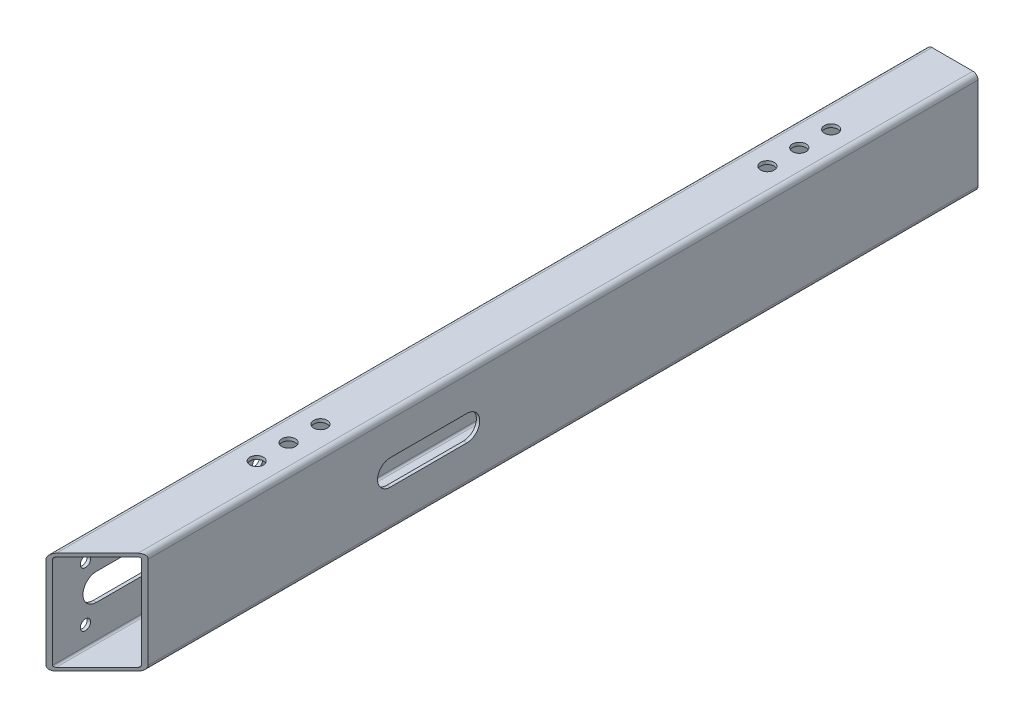
from build123d import *

# Parameters (mm, degrees)
EXTRUDE_THIN1_START       = -406.4
EXTRUDE_THIN1_DEPTH       = 438.15
EXTRUDE_THIN1_START_2     = 13.470384182
EXTRUDE_THIN1_2_OUTLINE_W = 39
EXTRUDE_THIN1_2_OUTLINE_H = 54
EXTRUDE_THIN1_2_DEPTH     = 18.529615818
CUT_EXTRUDE2_REACH        = 409.984
CUT_EXTRUDE4_REACH        = 409.984
SKETCH5_R                 = 2.5527
CUT_EXTRUDE3_DEPTH        = 1.651
F_1_4_CLEARANCE_HOLE1_D   = 6.7564


with BuildPart() as part:
    # Extrude-Thin1: read off the stored shape, not the designer's step
    # Extrude-Thin1 outline → Extrude-Thin1 (new body)
    with BuildSketch(Plane.XY.offset(EXTRUDE_THIN1_START)):
        with BuildLine():
            ThreePointArc((-12.7, -22.86), (-11.956051224, -24.656051224), (-10.16, -25.4))
            Line((-10.16, -25.4), (10.16, -25.4))
            ThreePointArc((10.16, -25.4), (11.956051224, -24.656051224), (12.7, -22.86))
            Line((12.7, -22.86), (12.7, 22.86))
            ThreePointArc((12.7, 22.86), (11.956051224, 24.656051224), (10.16, 25.4))
            Line((10.16, 25.4), (-10.16, 25.4))
            ThreePointArc((-10.16, 25.4), (-11.956051224, 24.656051224), (-12.7, 22.86))
            Line((-12.7, 22.86), (-12.7, -22.86))
        make_face()
        with BuildLine():
            Line((10.16, -23.749), (-10.16, -23.749))
            ThreePointArc((-10.16, -23.749), (-10.788617928, -23.488617928), (-11.049, -22.86))
            Line((-11.049, -22.86), (-11.049, 22.86))
            ThreePointArc((-11.049, 22.86), (-10.788617928, 23.488617928), (-10.16, 23.749))
            Line((-10.16, 23.749), (10.16, 23.749))
            ThreePointArc((10.16, 23.749), (10.788617928, 23.488617928), (11.049, 22.86))
            Line((11.049, 22.86), (11.049, -22.86))
            ThreePointArc((11.049, -22.86), (10.788617928, -23.488617928), (10.16, -23.749))
        make_face(mode=Mode.SUBTRACT)
    extrude(amount=EXTRUDE_THIN1_DEPTH)

    # Extrude-Thin1 2 outline → Extrude-Thin1 2 (cut)
    with BuildSketch(Plane(origin=(0, 0, 0), x_dir=(0.707106781186548, 0, -0.707106781186547), z_dir=(0.707106781186547, 0, 0.707106781186548)).offset(EXTRUDE_THIN1_START_2)):
        with Locations((-13.5, 0)):
            Rectangle(EXTRUDE_THIN1_2_OUTLINE_W, EXTRUDE_THIN1_2_OUTLINE_H)
    extrude(amount=EXTRUDE_THIN1_2_DEPTH, mode=Mode.SUBTRACT)

    # Sketch3 → Cut-Extrude2 (cut, up to next)
    with BuildSketch(Plane.ZY.offset(12.7), mode=Mode.PRIVATE) as cut_extrude2_sk1:
        with BuildLine():
            Line((8.345953821, -6.6675), (-152.204543073, -6.6675))
            ThreePointArc((-152.204543073, -6.6675), (-158.872043073, 0), (-152.204543073, 6.6675))
            Line((-152.204543073, 6.6675), (8.345953821, 6.6675))
            ThreePointArc((8.345953821, 6.6675), (15.013453821, 0), (8.345953821, -6.6675))
        make_face()
    cut_extrude2_tool1 = extrude(cut_extrude2_sk1.sketch, amount=-CUT_EXTRUDE2_REACH, mode=Mode.PRIVATE) & part.part
    add(cut_extrude2_tool1.solids().sort_by_distance((-12.7, 0, -71.929295))[0], mode=Mode.SUBTRACT)

    # Sketch6 → Cut-Extrude4 (cut, up to next)
    with BuildSketch(Plane(origin=(12.7, 0, 0), x_dir=(0, 0, -1), z_dir=(1, 0, 0)), mode=Mode.PRIVATE) as cut_extrude4_sk1:
        with BuildLine():
            Line((114.104543073, 6.35), (152.204543073, 6.35))
            ThreePointArc((152.204543073, 6.35), (158.554543073, 0), (152.204543073, -6.35))
            Line((152.204543073, -6.35), (114.104543073, -6.35))
            ThreePointArc((114.104543073, -6.35), (107.754543073, 0), (114.104543073, 6.35))
        make_face()
    cut_extrude4_tool1 = extrude(cut_extrude4_sk1.sketch, amount=-CUT_EXTRUDE4_REACH, mode=Mode.PRIVATE) & part.part
    add(cut_extrude4_tool1.solids().sort_by_distance((12.7, 0, -133.154543))[0], mode=Mode.SUBTRACT)

    # Sketch5 → Cut-Extrude3 (cut)
    with BuildSketch(Plane(origin=(-12.7, 0, 0), x_dir=(0, 0, -1), z_dir=(1, 0, 0))):
        with Locations((-13.795705431, 13.589)):
            Circle(SKETCH5_R)
        with Locations((-13.795705431, -13.589)):
            Circle(SKETCH5_R)
        with Locations((71.929294569, -13.589)):
            Circle(SKETCH5_R)
        with Locations((71.929294569, 13.589)):
            Circle(SKETCH5_R)
        with Locations((157.654294569, 13.589)):
            Circle(SKETCH5_R)
        with Locations((157.654294569, -13.589)):
            Circle(SKETCH5_R)
    extrude(amount=CUT_EXTRUDE3_DEPTH, mode=Mode.SUBTRACT)

    # 1/4 Clearance Hole1 (through all)
    with Locations(Plane(origin=(0, 25.4, 0), x_dir=(1, 0, 0), z_dir=(0, 1, 0))):
        with Locations((0, 346.075), (0, 330.2), (0, 314.325), (0, 60.325), (0, 76.2), (0, 92.075)):
            Hole(F_1_4_CLEARANCE_HOLE1_D / 2)


solid = part.part
